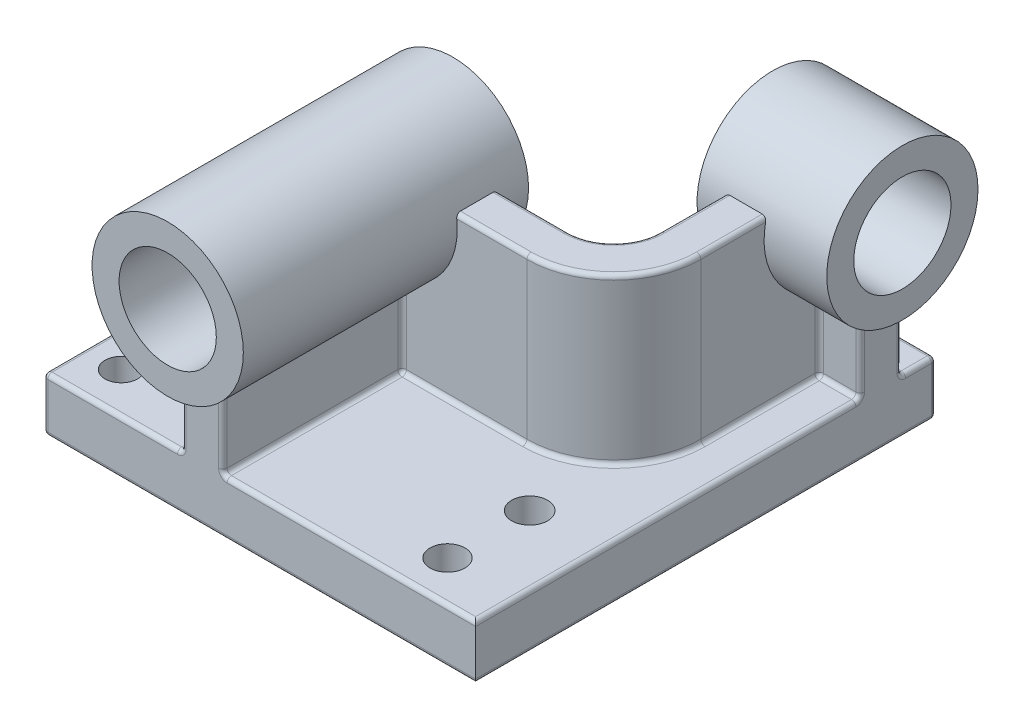
from build123d import *

# Parameters (mm, degrees)
BOSS_EXTRUDE1_DEPTH      = 25
BOSS_EXTRUDE2_DEPTH      = 76
EXTRUDE_THIN1_DEPTH      = 76
BOSS_EXTRUDE3_DEPTH      = 76
BOSS_EXTRUDE4_DEPTH      = 15.999999999999993
BOSS_EXTRUDE4_DEPTH_BACK = 116.00000000000001
SKETCH6_R                = 35.00000000000001
SKETCH6_R_2              = 22.5
SKETCH7_R                = 22.500000000000014
CUT_EXTRUDE1_DEPTH       = 116.00000000000001
BOSS_EXTRUDE5_DEPTH      = 10
BOSS_EXTRUDE5_DEPTH_BACK = 50
SKETCH8_R                = 35.00000000000001
SKETCH8_R_2              = 22.499999999999986
SKETCH9_R                = 22.499999999999982
CUT_EXTRUDE2_DEPTH       = 50
SKETCH10_R               = 8.081694570119302
SKETCH10_R_2             = 8.289410438207003
CUT_EXTRUDE3_DEPTH       = 25
SKETCH11_R               = 7.517931334572857
SKETCH11_R_2             = 7.883385612685223
CUT_EXTRUDE4_DEPTH       = 25
FILLET2_R                = 2


with BuildPart() as part:
    # Sketch1 → Boss-Extrude1 (new body)
    with BuildSketch(Plane(origin=(0, 0, 0), x_dir=(1, 0, 0), z_dir=(0, 1, 0))):
        with BuildLine():
            Line((-200, 0), (0, 0))
            Line((0, 0), (0, 213))
            Line((0, 213), (-38, 213))
            Line((-38, 213), (-38, 123.25984251968505))
            ThreePointArc((-38, 123.25984251968505), (-44.22686370705766, 108.22686370705766), (-59.25984251968506, 102))
            Line((-59.25984251968506, 102), (-200, 102))
            Line((-200, 102), (-200, 0))
        make_face()
    extrude(amount=BOSS_EXTRUDE1_DEPTH)

    # Sketch2 → Boss-Extrude2 (add)
    with BuildSketch(Plane(origin=(0, 25, 0), x_dir=(1, 0, 0), z_dir=(0, 1, 0))):
        Polygon((-117, 0), (-136, -2.33e-15), (-136, 102), (-117, 102), align=None)
    extrude(amount=BOSS_EXTRUDE2_DEPTH)

    # Sketch3 → Extrude-Thin1 (add)
    with BuildSketch(Plane(origin=(0, 25, 0), x_dir=(1, 0, 0), z_dir=(0, 1, 0))):
        with BuildLine():
            Line((-117, 102), (-59.25984251968506, 102))
            ThreePointArc((-59.25984251968506, 102), (-44.226863707057724, 108.2268637070577), (-38, 123.25984251968505))
            Line((-38, 123.25984251968505), (-38, 213))
            Line((-38, 213), (-19, 213))
            Line((-19, 213), (-19, 123.25984251968505))
            ThreePointArc((-18.999999999999936, 123.259842519685), (-30.791834864513298, 94.79183486451332), (-59.25984251968494, 83))
            Line((-59.25984251968506, 83), (-117, 83))
            Line((-117, 83), (-117, 102))
        make_face()
    extrude(amount=EXTRUDE_THIN1_DEPTH)

    # Sketch4 → Boss-Extrude3 (add)
    with BuildSketch(Plane(origin=(0, 25, 0), x_dir=(1, 0, 0), z_dir=(0, 1, 0))):
        Polygon((0, 196.99999999999997), (-19, 196.99999999999997), (-19, 178), (1.04e-15, 178), align=None)
    extrude(amount=BOSS_EXTRUDE3_DEPTH)

    # Sketch6 → Boss-Extrude4 (add, two sides: drawn at the far end of the back side and taken through both)
    with BuildSketch(Plane.XY.offset(-BOSS_EXTRUDE4_DEPTH_BACK)):
        with Locations((-126.5, 94.98945292990969)):
            Circle(SKETCH6_R)
        with Locations((-126.5, 94.98945292990969)):
            Circle(SKETCH6_R_2, mode=Mode.SUBTRACT)
    extrude(amount=BOSS_EXTRUDE4_DEPTH + BOSS_EXTRUDE4_DEPTH_BACK)

    # Sketch7 → Cut-Extrude1 (cut)
    with BuildSketch(Plane.XY):
        with Locations((-126.5, 94.98945292990969)):
            Circle(SKETCH7_R)
    extrude(amount=-CUT_EXTRUDE1_DEPTH, mode=Mode.SUBTRACT)

    # Sketch8 → Boss-Extrude5 (add, two sides: drawn at the far end of the back side and taken through both)
    with BuildSketch(Plane(origin=(0, 0, 0), x_dir=(0, 0, -1), z_dir=(1, 0, 0)).offset(-BOSS_EXTRUDE5_DEPTH_BACK)):
        with Locations((187.5, 92.05285670887284)):
            Circle(SKETCH8_R)
        with Locations((187.5, 92.05285670887284)):
            Circle(SKETCH8_R_2, mode=Mode.SUBTRACT)
    extrude(amount=BOSS_EXTRUDE5_DEPTH + BOSS_EXTRUDE5_DEPTH_BACK)

    # Sketch9 → Cut-Extrude2 (cut)
    with BuildSketch(Plane(origin=(0, 0, 0), x_dir=(0, 0, -1), z_dir=(1, 0, 0))):
        with Locations((187.5, 92.05285670887284)):
            Circle(SKETCH9_R)
    extrude(amount=-CUT_EXTRUDE2_DEPTH, mode=Mode.SUBTRACT)

    # Sketch10 → Cut-Extrude3 (cut)
    with BuildSketch(Plane(origin=(0, 25, 0), x_dir=(1, 0, 0), z_dir=(0, 1, 0))):
        with Locations(Location((-32, 19, 0), (0, 0, 270))):
            Circle(SKETCH10_R)
        with Locations(Location((-32, 56.99999999999999, 0), (0, 0, 270))):
            Circle(SKETCH10_R_2)
    extrude(amount=-CUT_EXTRUDE3_DEPTH, mode=Mode.SUBTRACT)

    # Sketch11 → Cut-Extrude4 (cut)
    with BuildSketch(Plane(origin=(0, 25, 0), x_dir=(1, 0, 0), z_dir=(0, 1, 0))):
        with Locations(Location((-183, 19, 0), (0, 0, 270))):
            Circle(SKETCH11_R)
        with Locations(Location((-183, 57, 0), (0, 0, 270))):
            Circle(SKETCH11_R_2)
    extrude(amount=-CUT_EXTRUDE4_DEPTH, mode=Mode.SUBTRACT)

    # Fillet2
    # the kernel refuses this fillet: 2 mm, written as the material it adds along each edge
    with BuildSketch(Plane(origin=(-17, 27, -176), x_dir=(0, 0, -1), z_dir=(0, -1, 0))) as fillet2_piece_1_section:
        Polygon((0, 0), (FILLET2_R, 0), (FILLET2_R, -FILLET2_R), (0, -FILLET2_R), align=None)
    fillet2_piece_1 = extrude(amount=FILLET2_R, mode=Mode.PRIVATE)
    fillet2_piece_1 = fillet2_piece_1 - Plane(origin=(-17, 27, -176), x_dir=(0.7071067811865475, 0, 0.7071067811865475), z_dir=(0, -1, 0)) * Sphere(FILLET2_R, mode=Mode.PRIVATE)
    add(fillet2_piece_1)
    with BuildSketch(Plane(origin=(-17, 27, -198.99999999999997), x_dir=(0, 0, 1), z_dir=(0, -1, 0))) as fillet2_piece_2_section:
        Polygon((0, 0), (FILLET2_R, 0), (FILLET2_R, FILLET2_R), (0, FILLET2_R), align=None)
    fillet2_piece_2 = extrude(amount=FILLET2_R, mode=Mode.PRIVATE)
    fillet2_piece_2 = fillet2_piece_2 - Plane(origin=(-17, 27, -198.99999999999997), x_dir=(0.7071067811865475, 0, -0.7071067811865475), z_dir=(0, -1, 0)) * Sphere(FILLET2_R, mode=Mode.PRIVATE)
    add(fillet2_piece_2)
    with BuildSketch(Plane(origin=(-115, 27, -81), x_dir=(-1, 0, 0), z_dir=(0, -1, 0))) as fillet2_piece_3_section:
        Polygon((0, 0), (FILLET2_R, 0), (FILLET2_R, FILLET2_R), (0, FILLET2_R), align=None)
    fillet2_piece_3 = extrude(amount=FILLET2_R, mode=Mode.PRIVATE)
    fillet2_piece_3 = fillet2_piece_3 - Plane(origin=(-115, 27, -81), x_dir=(0.7071067811865475, 0, 0.7071067811865475), z_dir=(0, -1, 0)) * Sphere(FILLET2_R, mode=Mode.PRIVATE)
    add(fillet2_piece_3)
    with BuildSketch(Plane(origin=(-19, 27, -178), x_dir=(1, 0, 0), z_dir=(0, 1, 0))) as fillet2_piece_4:
        with BuildLine():
            CenterArc((FILLET2_R, -FILLET2_R), FILLET2_R, 90, 90)
            Line((0, -FILLET2_R), (0, 0))
            Line((0, 0), (FILLET2_R, 0))
        make_face()
    extrude(amount=36.366806183470054)
    with BuildSketch(Plane(origin=(-19, 27, -196.99999999999997), x_dir=(1, 0, 0), z_dir=(0, 1, 0))) as fillet2_piece_5:
        with BuildLine():
            CenterArc((FILLET2_R, FILLET2_R), FILLET2_R, 180, 90)
            Line((0, FILLET2_R), (0, 0))
            Line((0, 0), (FILLET2_R, 0))
        make_face()
    extrude(amount=36.366806183470054)
    with BuildSketch(Plane(origin=(-117, 25, -81), x_dir=(1, 0, 0), z_dir=(0, 0, 1))) as fillet2_piece_6:
        with BuildLine():
            CenterArc((FILLET2_R, FILLET2_R), FILLET2_R, 180, 90)
            Line((0, FILLET2_R), (0, 0))
            Line((0, 0), (FILLET2_R, 0))
        make_face()
    extrude(amount=81)
    with BuildSketch(Plane(origin=(-136, 25, 2.33e-15), x_dir=(0, 1, 0), z_dir=(0, 0, -1))) as fillet2_piece_7:
        with BuildLine():
            CenterArc((FILLET2_R, -FILLET2_R), FILLET2_R, 90, 90)
            Line((0, -FILLET2_R), (0, 0))
            Line((0, 0), (FILLET2_R, 0))
        make_face()
    extrude(amount=102)
    with BuildSketch(Plane(origin=(-19, 25, -176), x_dir=(1, 0, 0), z_dir=(0, 0, 1))) as fillet2_piece_8:
        with BuildLine():
            CenterArc((FILLET2_R, FILLET2_R), FILLET2_R, 180, 90)
            Line((0, FILLET2_R), (0, 0))
            Line((0, 0), (FILLET2_R, 0))
        make_face()
    extrude(amount=52.74015748031495)
    with BuildSketch(Plane(origin=(-59.25984251968506, 25, -83), x_dir=(0, 0, 1), z_dir=(-1, 0, 0))) as fillet2_piece_9:
        with BuildLine():
            CenterArc((FILLET2_R, FILLET2_R), FILLET2_R, 180, 90)
            Line((0, FILLET2_R), (0, 0))
            Line((0, 0), (FILLET2_R, 0))
        make_face()
    extrude(amount=55.74015748031494)
    with BuildSketch(Plane(origin=(-59.25984251968529, 25, -123.25984251968535), x_dir=(1, 0, 8.82e-15), z_dir=(8.82e-15, 0, -1))) as fillet2_piece_10:
        with BuildLine():
            CenterArc((40.25984251968535 + FILLET2_R, -FILLET2_R), FILLET2_R, 90, 90)
            Line((40.25984251968535, -FILLET2_R), (40.25984251968535, 0))
            Line((40.25984251968535, 0), (40.25984251968535 + FILLET2_R, 0))
        make_face()
    revolve(axis=Axis((-59.25984251968529, 25, -123.25984251968535), (0, -1, 0)), revolution_arc=89.99999999999899)
    with BuildSketch(Plane(origin=(-19, 25, -213), x_dir=(1, 0, 0), z_dir=(0, 0, 1))) as fillet2_piece_11:
        with BuildLine():
            CenterArc((FILLET2_R, FILLET2_R), FILLET2_R, 180, 90)
            Line((0, FILLET2_R), (0, 0))
            Line((0, 0), (FILLET2_R, 0))
        make_face()
    extrude(amount=14.000000000000028)
    with BuildSketch(Plane(origin=(0, 25, -196.99999999999997), x_dir=(0, 0, -1), z_dir=(-1, 0, 0)), Plane(origin=(-17, 25, -178), x_dir=(0, 0, 1), z_dir=(1, 0, 0))) as fillet2_piece_12:
        with BuildLine():
            CenterArc((FILLET2_R, -FILLET2_R), FILLET2_R, 90, 90)
            Line((0, -FILLET2_R), (0, 0))
            Line((0, 0), (FILLET2_R, 0))
        make_face()
    extrude(amount=17)
    with BuildSketch(Plane(origin=(-117, 27, -83), x_dir=(0, 0, 1), z_dir=(0, 1, 0))) as fillet2_piece_13:
        with BuildLine():
            CenterArc((FILLET2_R, FILLET2_R), FILLET2_R, 180, 90)
            Line((0, FILLET2_R), (0, 0))
            Line((0, 0), (FILLET2_R, 0))
        make_face()
    extrude(amount=39.3034024045067)
    # the kernel refuses this fillet: 2 mm, written as the material it takes off along each edge
    with BuildSketch(Plane(origin=(-198, 2, -100), x_dir=(0, -1, 0), z_dir=(-1, 0, 0))) as fillet2_2_piece_1_section:
        Polygon((0, 0), (FILLET2_R, 0), (FILLET2_R, -FILLET2_R), (0, -FILLET2_R), align=None)
    fillet2_2_piece_1 = extrude(amount=FILLET2_R, mode=Mode.PRIVATE)
    fillet2_2_piece_1 = fillet2_2_piece_1 - Plane(origin=(-198, 2, -100), x_dir=(0, 0.7071067811865475, 0.7071067811865475), z_dir=(-1, 0, 0)) * Sphere(FILLET2_R, mode=Mode.PRIVATE)
    add(fillet2_2_piece_1, mode=Mode.SUBTRACT)
    with BuildSketch(Plane(origin=(-198, 2, -2), x_dir=(0, -1, 0), z_dir=(-1, 0, 0))) as fillet2_2_piece_2_section:
        Polygon((0, 0), (FILLET2_R, 0), (FILLET2_R, FILLET2_R), (0, FILLET2_R), align=None)
    fillet2_2_piece_2 = extrude(amount=FILLET2_R, mode=Mode.PRIVATE)
    fillet2_2_piece_2 = fillet2_2_piece_2 - Plane(origin=(-198, 2, -2), x_dir=(0, 0.7071067811865475, -0.7071067811865475), z_dir=(-1, 0, 0)) * Sphere(FILLET2_R, mode=Mode.PRIVATE)
    add(fillet2_2_piece_2, mode=Mode.SUBTRACT)
    with BuildSketch(Plane(origin=(-36, 2, -211), x_dir=(0, 0, -1), z_dir=(0, -1, 0))) as fillet2_2_piece_3_section:
        Polygon((0, 0), (FILLET2_R, 0), (FILLET2_R, -FILLET2_R), (0, -FILLET2_R), align=None)
    fillet2_2_piece_3 = extrude(amount=FILLET2_R, mode=Mode.PRIVATE)
    fillet2_2_piece_3 = fillet2_2_piece_3 - Plane(origin=(-36, 2, -211), x_dir=(0.7071067811865475, 0, 0.7071067811865475), z_dir=(0, -1, 0)) * Sphere(FILLET2_R, mode=Mode.PRIVATE)
    add(fillet2_2_piece_3, mode=Mode.SUBTRACT)
    with BuildSketch(Plane(origin=(-2, 2, -211), x_dir=(1, 0, 0), z_dir=(0, -1, 0))) as fillet2_2_piece_4_section:
        Polygon((0, 0), (FILLET2_R, 0), (FILLET2_R, -FILLET2_R), (0, -FILLET2_R), align=None)
    fillet2_2_piece_4 = extrude(amount=FILLET2_R, mode=Mode.PRIVATE)
    fillet2_2_piece_4 = fillet2_2_piece_4 - Plane(origin=(-2, 2, -211), x_dir=(-0.7071067811865475, 0, 0.7071067811865475), z_dir=(0, -1, 0)) * Sphere(FILLET2_R, mode=Mode.PRIVATE)
    add(fillet2_2_piece_4, mode=Mode.SUBTRACT)
    with BuildSketch(Plane(origin=(-200, 0, -100), x_dir=(1, 0, 0), z_dir=(0, 0, 1))) as fillet2_2_piece_5:
        with BuildLine():
            CenterArc((FILLET2_R, FILLET2_R), FILLET2_R, 180, 90)
            Line((0, FILLET2_R), (0, 0))
            Line((0, 0), (FILLET2_R, 0))
        make_face()
    extrude(amount=98, mode=Mode.SUBTRACT)
    with BuildSketch(Plane(origin=(-38, 1.9999999999999996, -213), x_dir=(1, 0, 0), z_dir=(0, 1, 0))) as fillet2_2_piece_6_section:
        with BuildLine():
            CenterArc((FILLET2_R, -FILLET2_R), FILLET2_R, 90, 90)
            Line((0, -FILLET2_R), (0, 0))
            Line((0, 0), (FILLET2_R, 0))
        make_face()
    fillet2_2_piece_6 = extrude(amount=71.07891251939922, mode=Mode.PRIVATE)
    fillet2_2_piece_6 = fillet2_2_piece_6 - Plane(origin=(-37.545512712394, 92.05285670887284, -187.5), x_dir=(0, 0, -1), z_dir=(1, 0, 0)) * Cylinder(35.00000000000001, 151, mode=Mode.PRIVATE)
    add(fillet2_2_piece_6, mode=Mode.SUBTRACT)
    with BuildSketch(Plane(origin=(-200, 2, -102), x_dir=(0, 0, 1), z_dir=(0, 1, 0))) as fillet2_2_piece_7:
        with BuildLine():
            CenterArc((FILLET2_R, FILLET2_R), FILLET2_R, 180, 90)
            Line((0, FILLET2_R), (0, 0))
            Line((0, 0), (FILLET2_R, 0))
        make_face()
    extrude(amount=28, mode=Mode.SUBTRACT)
    with BuildSketch(Plane(origin=(0, 2, -213), x_dir=(0, 0, 1), z_dir=(0, 1, 0))) as fillet2_2_piece_8:
        with BuildLine():
            CenterArc((FILLET2_R, -FILLET2_R), FILLET2_R, 90, 90)
            Line((0, -FILLET2_R), (0, 0))
            Line((0, 0), (FILLET2_R, 0))
        make_face()
    extrude(amount=28, mode=Mode.SUBTRACT)
    with BuildSketch(Plane(origin=(-200, 2, 0), x_dir=(1, 0, 0), z_dir=(0, 1, 0))) as fillet2_2_piece_9:
        with BuildLine():
            CenterArc((FILLET2_R, FILLET2_R), FILLET2_R, 180, 90)
            Line((0, FILLET2_R), (0, 0))
            Line((0, 0), (FILLET2_R, 0))
        make_face()
    extrude(amount=28, mode=Mode.SUBTRACT)
    with BuildSketch(Plane(origin=(-59.25984251968506, 101, -102), x_dir=(0, -1, 0), z_dir=(-1, 0, 0))) as fillet2_2_piece_10_section:
        with BuildLine():
            CenterArc((FILLET2_R, FILLET2_R), FILLET2_R, 180, 90)
            Line((0, FILLET2_R), (0, 0))
            Line((0, 0), (FILLET2_R, 0))
        make_face()
    fillet2_2_piece_10 = extrude(amount=37.76011508013472, mode=Mode.PRIVATE)
    fillet2_2_piece_10 = fillet2_2_piece_10 - Plane(origin=(-126.5, 94.98945292990969, -101.54668472366969), x_dir=(1, 0, 0), z_dir=(0, 0, 1)) * Cylinder(35.00000000000001, 84, mode=Mode.PRIVATE)
    add(fillet2_2_piece_10, mode=Mode.SUBTRACT)
    with BuildSketch(Plane(origin=(-38, 101, -123.25984251968505), x_dir=(0, -1, 0), z_dir=(0, 0, -1))) as fillet2_2_piece_11_section:
        with BuildLine():
            CenterArc((FILLET2_R, -FILLET2_R), FILLET2_R, 90, 90)
            Line((0, -FILLET2_R), (0, 0))
            Line((0, 0), (FILLET2_R, 0))
        make_face()
    fillet2_2_piece_11 = extrude(amount=35.403067964104665, mode=Mode.PRIVATE)
    fillet2_2_piece_11 = fillet2_2_piece_11 - Plane(origin=(-37.54631731499938, 92.05285670887284, -187.5), x_dir=(0, 0, -1), z_dir=(1, 0, 0)) * Cylinder(35.00000000000001, 79, mode=Mode.PRIVATE)
    add(fillet2_2_piece_11, mode=Mode.SUBTRACT)
    with BuildSketch(Plane(origin=(-59.25984251968525, 101, -123.25984251968524), x_dir=(9.02e-15, 0, 1), z_dir=(-1, 0, 9.02e-15))) as fillet2_2_piece_12:
        with BuildLine():
            CenterArc((21.259842519685236 + FILLET2_R, -FILLET2_R), FILLET2_R, 90, 90)
            Line((21.259842519685236 + FILLET2_R, 0), (21.259842519685236, 0))
            Line((21.259842519685236, 0), (21.259842519685236, -FILLET2_R))
        make_face()
    revolve(axis=Axis((-59.25984251968525, 101, -123.25984251968524), (0, 1, 0)), revolution_arc=89.99999999999899, mode=Mode.SUBTRACT)
    with BuildSketch(Plane(origin=(-19, 101, -158.66291048378966), x_dir=(-1, 0, 0), z_dir=(0, 0, 1))) as fillet2_2_piece_13_section:
        with BuildLine():
            CenterArc((FILLET2_R, FILLET2_R), FILLET2_R, 180, 90)
            Line((0, FILLET2_R), (0, 0))
            Line((0, 0), (FILLET2_R, 0))
        make_face()
    fillet2_2_piece_13 = extrude(amount=35.40306796410461, mode=Mode.PRIVATE)
    fillet2_2_piece_13 = fillet2_2_piece_13 - Plane(origin=(-19.453681183831872, 92.05285670887284, -187.5), x_dir=(0, 0, -1), z_dir=(1, 0, 0)) * Cylinder(35.00000000000001, 79, mode=Mode.PRIVATE)
    add(fillet2_2_piece_13, mode=Mode.SUBTRACT)
    with BuildSketch(Plane(origin=(-59.25984251968529, 101, -123.25984251968535), x_dir=(1, 0, 8.82e-15), z_dir=(8.82e-15, 0, -1))) as fillet2_2_piece_14:
        with BuildLine():
            CenterArc((40.25984251968535 - FILLET2_R, FILLET2_R), FILLET2_R, 270, 90)
            Line((40.25984251968535, FILLET2_R), (40.25984251968535, 0))
            Line((40.25984251968535, 0), (40.25984251968535 - FILLET2_R, 0))
        make_face()
    revolve(axis=Axis((-59.25984251968529, 101, -123.25984251968535), (0, -1, 0)), revolution_arc=89.99999999999899, mode=Mode.SUBTRACT)
    with BuildSketch(Plane(origin=(-200, 25, -107), x_dir=(1, 0, 0), z_dir=(0, 0, 1))) as fillet2_2_piece_15:
        with BuildLine():
            CenterArc((FILLET2_R, -FILLET2_R), FILLET2_R, 90, 90)
            Line((0, -FILLET2_R), (0, 0))
            Line((0, 0), (FILLET2_R, 0))
        make_face()
    extrude(amount=112, mode=Mode.SUBTRACT)
    with BuildSketch(Plane(origin=(-59.25984251968506, 101, -83), x_dir=(0, 0, -1), z_dir=(-1, 0, 0))) as fillet2_2_piece_16_section:
        with BuildLine():
            CenterArc((FILLET2_R, FILLET2_R), FILLET2_R, 180, 90)
            Line((0, FILLET2_R), (0, 0))
            Line((0, 0), (FILLET2_R, 0))
        make_face()
    fillet2_2_piece_16 = extrude(amount=37.76011508013472, mode=Mode.PRIVATE)
    fillet2_2_piece_16 = fillet2_2_piece_16 - Plane(origin=(-126.5, 94.98945292990969, -83.45331853244146), x_dir=(1, 0, 0), z_dir=(0, 0, 1)) * Cylinder(35.00000000000001, 84, mode=Mode.PRIVATE)
    add(fillet2_2_piece_16, mode=Mode.SUBTRACT)
    with BuildSketch(Plane(origin=(-59.25984251968506, 0, -102), x_dir=(0, 0, 1), z_dir=(-1, 0, 0))) as fillet2_2_piece_17:
        with BuildLine():
            CenterArc((FILLET2_R, FILLET2_R), FILLET2_R, 180, 90)
            Line((0, FILLET2_R), (0, 0))
            Line((0, 0), (FILLET2_R, 0))
        make_face()
    extrude(amount=138.74015748031493, mode=Mode.SUBTRACT)
    with BuildSketch(Plane(origin=(-59.259842519685066, 0, -123.25984251968507), x_dir=(1, 0, 6.7e-16), z_dir=(6.7e-16, 0, -1))) as fillet2_2_piece_18:
        with BuildLine():
            CenterArc((21.259842519685066 + FILLET2_R, -FILLET2_R), FILLET2_R, 90, 90)
            Line((21.259842519685066, -FILLET2_R), (21.259842519685066, 0))
            Line((21.259842519685066, 0), (21.259842519685066 + FILLET2_R, 0))
        make_face()
    revolve(axis=Axis((-59.259842519685066, 0, -123.25984251968507), (0, -1, 0)), revolution_arc=89.99999999999994, mode=Mode.SUBTRACT)
    with BuildSketch(Plane(origin=(-38, 0, -211), x_dir=(1, 0, 0), z_dir=(0, 0, 1))) as fillet2_2_piece_19:
        with BuildLine():
            CenterArc((FILLET2_R, FILLET2_R), FILLET2_R, 180, 90)
            Line((0, FILLET2_R), (0, 0))
            Line((0, 0), (FILLET2_R, 0))
        make_face()
    extrude(amount=87.74015748031495, mode=Mode.SUBTRACT)
    with BuildSketch(Plane(origin=(-2, 0, -213), x_dir=(0, 0, 1), z_dir=(-1, 0, 0))) as fillet2_2_piece_20:
        with BuildLine():
            CenterArc((FILLET2_R, FILLET2_R), FILLET2_R, 180, 90)
            Line((0, FILLET2_R), (0, 0))
            Line((0, 0), (FILLET2_R, 0))
        make_face()
    extrude(amount=34, mode=Mode.SUBTRACT)
    with BuildSketch(Plane(origin=(0, 0, 5), x_dir=(-1, 0, 0), z_dir=(0, 0, -1))) as fillet2_2_piece_21:
        with BuildLine():
            CenterArc((FILLET2_R, FILLET2_R), FILLET2_R, 180, 90)
            Line((0, FILLET2_R), (0, 0))
            Line((0, 0), (FILLET2_R, 0))
        make_face()
    extrude(amount=216, mode=Mode.SUBTRACT)
    with BuildSketch(Plane(origin=(-198, 0, 0), x_dir=(0, 1, 0), z_dir=(1, 0, 0))) as fillet2_2_piece_22:
        with BuildLine():
            CenterArc((FILLET2_R, -FILLET2_R), FILLET2_R, 90, 90)
            Line((-2.2e-16, -FILLET2_R), (0, 0))
            Line((0, 0), (FILLET2_R, 0))
        make_face()
    extrude(amount=202.99999999999997, mode=Mode.SUBTRACT)
    # the kernel refuses this fillet: 2 mm, written as the material it takes off along each edge
    with BuildSketch(Plane(origin=(-198, 23, -2), x_dir=(0, 1, 0), z_dir=(0, 0, 1))) as fillet2_3_piece_1_section:
        Polygon((0, 0), (FILLET2_R, 0), (FILLET2_R, FILLET2_R), (0, FILLET2_R), align=None)
    fillet2_3_piece_1 = extrude(amount=FILLET2_R, mode=Mode.PRIVATE)
    fillet2_3_piece_1 = fillet2_3_piece_1 - Plane(origin=(-198, 23, -2), x_dir=(0.7071067811865475, -0.7071067811865475, 0), z_dir=(0, 0, 1)) * Sphere(FILLET2_R, mode=Mode.PRIVATE)
    add(fillet2_3_piece_1, mode=Mode.SUBTRACT)
    with BuildSketch(Plane(origin=(-198, 23, -100), x_dir=(0, 0, -1), z_dir=(0, 1, 0))) as fillet2_3_piece_2_section:
        Polygon((0, 0), (FILLET2_R, 0), (FILLET2_R, FILLET2_R), (0, FILLET2_R), align=None)
    fillet2_3_piece_2 = extrude(amount=FILLET2_R, mode=Mode.PRIVATE)
    fillet2_3_piece_2 = fillet2_3_piece_2 - Plane(origin=(-198, 23, -100), x_dir=(0.7071067811865475, 0, 0.7071067811865475), z_dir=(0, 1, 0)) * Sphere(FILLET2_R, mode=Mode.PRIVATE)
    add(fillet2_3_piece_2, mode=Mode.SUBTRACT)
    with BuildSketch(Plane(origin=(1.04e-15, 27, -178), x_dir=(-5.2e-16, 0, -1), z_dir=(0, 1, 0))) as fillet2_3_piece_3_section:
        with BuildLine():
            CenterArc((FILLET2_R, FILLET2_R), FILLET2_R, 179.99999999999997, 90)
            Line((1.04e-15, FILLET2_R), (0, 0))
            Line((0, 0), (FILLET2_R, 0))
        make_face()
    fillet2_3_piece_3 = extrude(amount=36.36680618347058, mode=Mode.PRIVATE)
    fillet2_3_piece_3 = fillet2_3_piece_3 - Plane(origin=(-0.4537163380660755, 92.05285670887284, -187.5), x_dir=(0, 0, -1), z_dir=(-1, 0, 0)) * Cylinder(35.00000000000001, 81, mode=Mode.PRIVATE)
    add(fillet2_3_piece_3, mode=Mode.SUBTRACT)
    with BuildSketch(Plane(origin=(0, 27, -196.99999999999997), x_dir=(0, 0, 1), z_dir=(0, 1, 0))) as fillet2_3_piece_4_section:
        with BuildLine():
            CenterArc((FILLET2_R, -FILLET2_R), FILLET2_R, 90, 90)
            Line((0, -FILLET2_R), (0, 0))
            Line((0, 0), (FILLET2_R, 0))
        make_face()
    fillet2_3_piece_4 = extrude(amount=36.3668061834701, mode=Mode.PRIVATE)
    fillet2_3_piece_4 = fillet2_3_piece_4 - Plane(origin=(-0.45371500871735054, 92.05285670887284, -187.5), x_dir=(0, 0, -1), z_dir=(-1, 0, 0)) * Cylinder(35.00000000000001, 81, mode=Mode.PRIVATE)
    add(fillet2_3_piece_4, mode=Mode.SUBTRACT)
    with BuildSketch(Plane(origin=(-19, 27, -213), x_dir=(-1, 0, 0), z_dir=(0, 1, 0))) as fillet2_3_piece_5_section:
        with BuildLine():
            CenterArc((FILLET2_R, FILLET2_R), FILLET2_R, 180, 90)
            Line((0, FILLET2_R), (0, 0))
            Line((0, 0), (FILLET2_R, 0))
        make_face()
    fillet2_3_piece_5 = extrude(amount=46.07891251939935, mode=Mode.PRIVATE)
    fillet2_3_piece_5 = fillet2_3_piece_5 - Plane(origin=(-19.45553209612987, 92.05285670887284, -187.5), x_dir=(0, 0, -1), z_dir=(1, 0, 0)) * Cylinder(35.00000000000001, 101, mode=Mode.PRIVATE)
    add(fillet2_3_piece_5, mode=Mode.SUBTRACT)
    with BuildSketch(Plane(origin=(0, 25, 5), x_dir=(0, -1, 0), z_dir=(0, 0, -1))) as fillet2_3_piece_6:
        with BuildLine():
            CenterArc((FILLET2_R, FILLET2_R), FILLET2_R, 180, 90)
            Line((0, FILLET2_R), (0, 0))
            Line((0, 0), (FILLET2_R, 0))
        make_face()
    extrude(amount=181, mode=Mode.SUBTRACT)
    with BuildSketch(Plane(origin=(-1.9999999999999998, 25, -213), x_dir=(0, 0, 1), z_dir=(-1, 0, 0))) as fillet2_3_piece_7:
        with BuildLine():
            CenterArc((FILLET2_R, -FILLET2_R), FILLET2_R, 90, 90)
            Line((0, -FILLET2_R), (0, 0))
            Line((0, 0), (FILLET2_R, 0))
        make_face()
    extrude(amount=15, mode=Mode.SUBTRACT)
    with BuildSketch(Plane(origin=(-115, 25, 0), x_dir=(0, -1, 0), z_dir=(1, 0, 0))) as fillet2_3_piece_8:
        with BuildLine():
            CenterArc((FILLET2_R, FILLET2_R), FILLET2_R, 180, 90)
            Line((0, FILLET2_R), (0, 0))
            Line((0, 0), (FILLET2_R, 0))
        make_face()
    extrude(amount=120, mode=Mode.SUBTRACT)
    with BuildSketch(Plane(origin=(-138, 25, -102), x_dir=(0, 0, 1), z_dir=(-1, 0, 0))) as fillet2_3_piece_9:
        with BuildLine():
            CenterArc((FILLET2_R, -FILLET2_R), FILLET2_R, 90, 90)
            Line((0, -FILLET2_R), (0, 0))
            Line((0, 0), (FILLET2_R, 0))
        make_face()
    extrude(amount=60, mode=Mode.SUBTRACT)
    with BuildSketch(Plane(origin=(0, 25, -198.99999999999997), x_dir=(0, -1, 0), z_dir=(0, 0, -1))) as fillet2_3_piece_10:
        with BuildLine():
            CenterArc((FILLET2_R, FILLET2_R), FILLET2_R, 180, 90)
            Line((0, FILLET2_R), (0, 0))
            Line((0, 0), (FILLET2_R, 0))
        make_face()
    extrude(amount=12.000000000000028, mode=Mode.SUBTRACT)
    with BuildSketch(Plane(origin=(-136, 27, 2.33e-15), x_dir=(1, 0, -1.16e-15), z_dir=(0, 1, 0))) as fillet2_3_piece_11_section:
        with BuildLine():
            CenterArc((FILLET2_R, FILLET2_R), FILLET2_R, 180, 89.99999999999994)
            Line((2.33e-15, FILLET2_R), (0, 0))
            Line((0, 0), (FILLET2_R, 0))
        make_face()
    fillet2_3_piece_11 = extrude(amount=39.30340240450701, mode=Mode.PRIVATE)
    fillet2_3_piece_11 = fillet2_3_piece_11 - Plane(origin=(-126.5, 94.98945292990969, -0.4536368166185307), x_dir=(1, 0, 0), z_dir=(0, 0, -1)) * Cylinder(35.00000000000001, 87, mode=Mode.PRIVATE)
    add(fillet2_3_piece_11, mode=Mode.SUBTRACT)
    with BuildSketch(Plane(origin=(-136, 27, -102), x_dir=(0, 0, 1), z_dir=(0, 1, 0))) as fillet2_3_piece_12_section:
        with BuildLine():
            CenterArc((FILLET2_R, FILLET2_R), FILLET2_R, 180, 90)
            Line((0, FILLET2_R), (0, 0))
            Line((0, 0), (FILLET2_R, 0))
        make_face()
    fillet2_3_piece_12 = extrude(amount=39.3034024045067, mode=Mode.PRIVATE)
    fillet2_3_piece_12 = fillet2_3_piece_12 - Plane(origin=(-126.5, 94.98945292990969, -101.54636368208298), x_dir=(1, 0, 0), z_dir=(0, 0, 1)) * Cylinder(35.00000000000001, 87, mode=Mode.PRIVATE)
    add(fillet2_3_piece_12, mode=Mode.SUBTRACT)
    with BuildSketch(Plane(origin=(-117, 27, 0), x_dir=(-1, 0, 0), z_dir=(0, 1, 0))) as fillet2_3_piece_13_section:
        with BuildLine():
            CenterArc((FILLET2_R, -FILLET2_R), FILLET2_R, 90, 90)
            Line((0, -FILLET2_R), (0, 0))
            Line((0, 0), (FILLET2_R, 0))
        make_face()
    fillet2_3_piece_13 = extrude(amount=39.303402404506926, mode=Mode.PRIVATE)
    fillet2_3_piece_13 = fillet2_3_piece_13 - Plane(origin=(-126.5, 94.98945292990969, -0.4536354860367652), x_dir=(1, 0, 0), z_dir=(0, 0, -1)) * Cylinder(35.00000000000001, 87, mode=Mode.PRIVATE)
    add(fillet2_3_piece_13, mode=Mode.SUBTRACT)
    with BuildSketch(Plane(origin=(-198, 25, 0), x_dir=(0, -1, 0), z_dir=(1, 0, 0))) as fillet2_3_piece_14:
        with BuildLine():
            CenterArc((FILLET2_R, FILLET2_R), FILLET2_R, 180, 90)
            Line((0, FILLET2_R), (0, 0))
            Line((0, 0), (FILLET2_R, 0))
        make_face()
    extrude(amount=60, mode=Mode.SUBTRACT)
    with BuildSketch(Plane(origin=(-138, 27, 2.33e-15), x_dir=(1, 0, 0), z_dir=(0, 1, 0))) as fillet2_3_piece_15:
        with BuildLine():
            CenterArc((2 + FILLET2_R, FILLET2_R), FILLET2_R, 180.00000000000006, 89.99999999999994)
            Line((2, FILLET2_R), (2, 0))
            Line((2, 0), (2 + FILLET2_R, 2.33e-15))
        make_face()
    revolve(axis=Axis((-138, 27, 2.33e-15), (0, 0, -1)), revolution_arc=90, mode=Mode.SUBTRACT)
    with BuildSketch(Plane(origin=(-115, 27, 0), x_dir=(0, -1, 0), z_dir=(1, 0, 0))) as fillet2_3_piece_16:
        with BuildLine():
            CenterArc((2 + FILLET2_R, FILLET2_R), FILLET2_R, 180, 90)
            Line((2, FILLET2_R), (2, 0))
            Line((2, 0), (2 + FILLET2_R, 0))
        make_face()
    revolve(axis=Axis((-115, 27, 0), (0, 0, -1)), revolution_arc=90, mode=Mode.SUBTRACT)
    with BuildSketch(Plane(origin=(-138, 27, -102), x_dir=(1, 0, 0), z_dir=(0, 1, 0))) as fillet2_3_piece_17:
        with BuildLine():
            CenterArc((2 + FILLET2_R, -FILLET2_R), FILLET2_R, 90, 90)
            Line((2 + FILLET2_R, 0), (2, 0))
            Line((2, 0), (2, -FILLET2_R))
        make_face()
    revolve(axis=Axis((-138, 27, -102), (0, 0, -1)), revolution_arc=90, mode=Mode.SUBTRACT)
    with BuildSketch(Plane(origin=(0, 27, -198.99999999999997), x_dir=(0, -1, 0), z_dir=(0, 0, -1))) as fillet2_3_piece_18:
        with BuildLine():
            CenterArc((2 + FILLET2_R, FILLET2_R), FILLET2_R, 180, 90)
            Line((2, FILLET2_R), (2, 0))
            Line((2, 0), (2 + FILLET2_R, 0))
        make_face()
    revolve(axis=Axis((0, 27, -198.99999999999997), (-1, 0, 0)), revolution_arc=90, mode=Mode.SUBTRACT)
    with BuildSketch(Plane(origin=(-2, 25, -211), x_dir=(-2.2e-16, 0, -1), z_dir=(-1, 0, 2.2e-16))) as fillet2_3_piece_19:
        with BuildLine():
            CenterArc((2 - FILLET2_R, FILLET2_R), FILLET2_R, 270, 90)
            Line((2 - FILLET2_R, 0), (2, 0))
            Line((2, 0), (2, FILLET2_R))
        make_face()
    revolve(axis=Axis((-2, 25, -211), (0, -1, 0)), revolution_arc=90, mode=Mode.SUBTRACT)
    with BuildSketch(Plane(origin=(-17, 27, -213), x_dir=(0, -1, 0), z_dir=(1, 0, 0))) as fillet2_3_piece_20:
        with BuildLine():
            CenterArc((2 + FILLET2_R, -FILLET2_R), FILLET2_R, 90, 90)
            Line((2 + FILLET2_R, 0), (2, 0))
            Line((2, 0), (2, -FILLET2_R))
        make_face()
    revolve(axis=Axis((-17, 27, -213), (0, 0, -1)), revolution_arc=90, mode=Mode.SUBTRACT)
    with BuildSketch(Plane(origin=(0, 27, -176), x_dir=(0, -1, 0), z_dir=(0, 0, 1))) as fillet2_3_piece_21:
        with BuildLine():
            CenterArc((2 + FILLET2_R, -FILLET2_R), FILLET2_R, 90, 90)
            Line((2, -FILLET2_R), (2, 0))
            Line((2, 0), (2 + FILLET2_R, 0))
        make_face()
    revolve(axis=Axis((0, 27, -176), (1, 0, 0)), revolution_arc=90, mode=Mode.SUBTRACT)


solid = part.part
